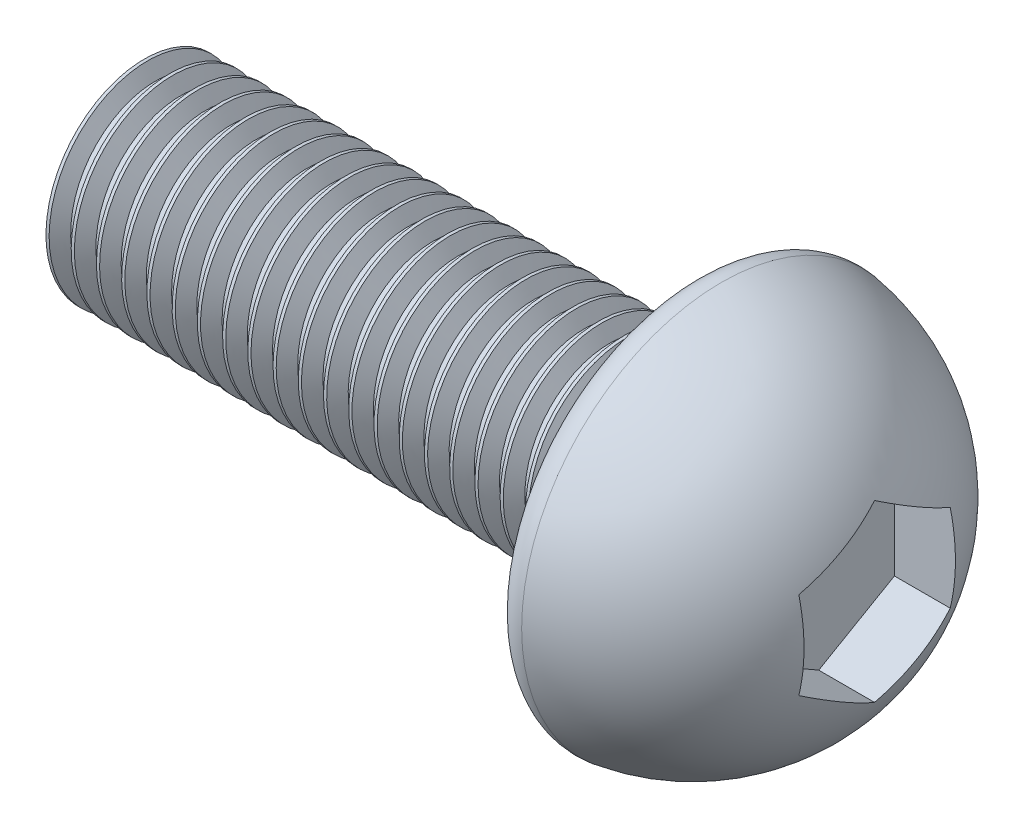
from build123d import *

# Parameters (mm, degrees)
THREAD1_PITCH      = 1
CUT_EXTRUDE1_DEPTH = 10
FILLET1_R          = 1


with BuildPart() as part:
    # Sketch1 → Revolve1 (revolve)
    with BuildSketch(Plane.XY, mode=Mode.PRIVATE) as revolve1_sk:
        with BuildLine():
            Line((0, 0), (0, 4))
            Line((0, 4), (22, 4))
            Line((22, 4), (22, 8))
            ThreePointArc((22, 8), (27.656854249, 5.656854249), (30, 0))
            Line((30, 0), (0, 0))
        make_face()
    revolve(revolve1_sk.sketch.rotate(Axis((0, 0, 0), (1, 0, 0)), 180), axis=Axis((0, 0, 0), (1, 0, 0)))

    # Thread1: the profile of Thread Profile1 profile screwed along a right-hand helix of 25 turns, 8 arcs to a turn; built about Z, then put on its axis
    thread1_z = Axis((0, 0, 0), (0, 0, 1))
    thread1_corners = [(4.0003, 0, -0.000173205), (4.0003, 0, 0.875173202), (3.458734125, 0, 0.562499999), (3.458734125, 0, 0.312499999)]
    with BuildLine(mode=Mode.PRIVATE) as thread1_profile:
        Line(thread1_corners[0], thread1_corners[1])
        Line(thread1_corners[1], thread1_corners[2])
        Line(thread1_corners[2], thread1_corners[3])
        Line(thread1_corners[3], thread1_corners[0])
    thread1_cap = Face(thread1_profile.wire())
    thread1_turn_angles = [0, 22.5, 45, 67.5, 90, 112.5, 135, 157.5, 180, 202.5, 225, 247.5, 270, 292.5, 315, 337.5, 360]
    thread1_turn_weights = [1, 0.9238795325112867, 1, 0.9238795325112867, 1, 0.9238795325112867, 1, 0.9238795325112867, 1, 0.9238795325112867, 1, 0.9238795325112867, 1, 0.9238795325112867, 1, 0.9238795325112867, 1]
    thread1_turn_rails = [Edge.make_bspline([Vector(p[0], p[1], 0).rotate(thread1_z, thread1_turn_angles[k]) / thread1_turn_weights[k] + Vector(0, 0, p[2] + THREAD1_PITCH * thread1_turn_angles[k] / 360) for k in range(17)], [0, 0, 0, 1, 1, 2, 2, 3, 3, 4, 4, 5, 5, 6, 6, 7, 7, 8, 8, 8], 2, thread1_turn_weights) for p in thread1_corners]
    thread1_turn_sides = [Face.make_surface_from_curves(thread1_turn_rails[p[0]], thread1_turn_rails[p[1]]) for p in [(0, 1), (1, 2), (2, 3), (3, 0)]]
    thread1 = Plane(origin=(-3, 0, 0), x_dir=(0, 0, -1), z_dir=(1, 0, 0)) * Solid(Shell([*[p.moved(Location((0, 0, THREAD1_PITCH * i))) for i in range(25) for p in thread1_turn_sides], thread1_cap, thread1_cap.rotate(thread1_z, 9000).moved(Location((0, 0, THREAD1_PITCH * 9000 / 360)))]))
    add(thread1, mode=Mode.SUBTRACT)

    # Sketch5 → Cut-Extrude1 (cut)
    with BuildSketch(Plane.ZY.offset(-27)):
        Polygon((0, 3.464101615), (-3, 1.732050808), (-3, -1.732050808), (0, -3.464101615), (3, -1.732050808), (3, 1.732050808), align=None)
    extrude(amount=-CUT_EXTRUDE1_DEPTH, mode=Mode.SUBTRACT)

    # Fillet1
    fillet1_edges = [part.edges().sort_by_distance(p)[0] for p in [
        (22, 8, 0),
    ]]
    fillet(fillet1_edges, radius=FILLET1_R)


solid = part.part
